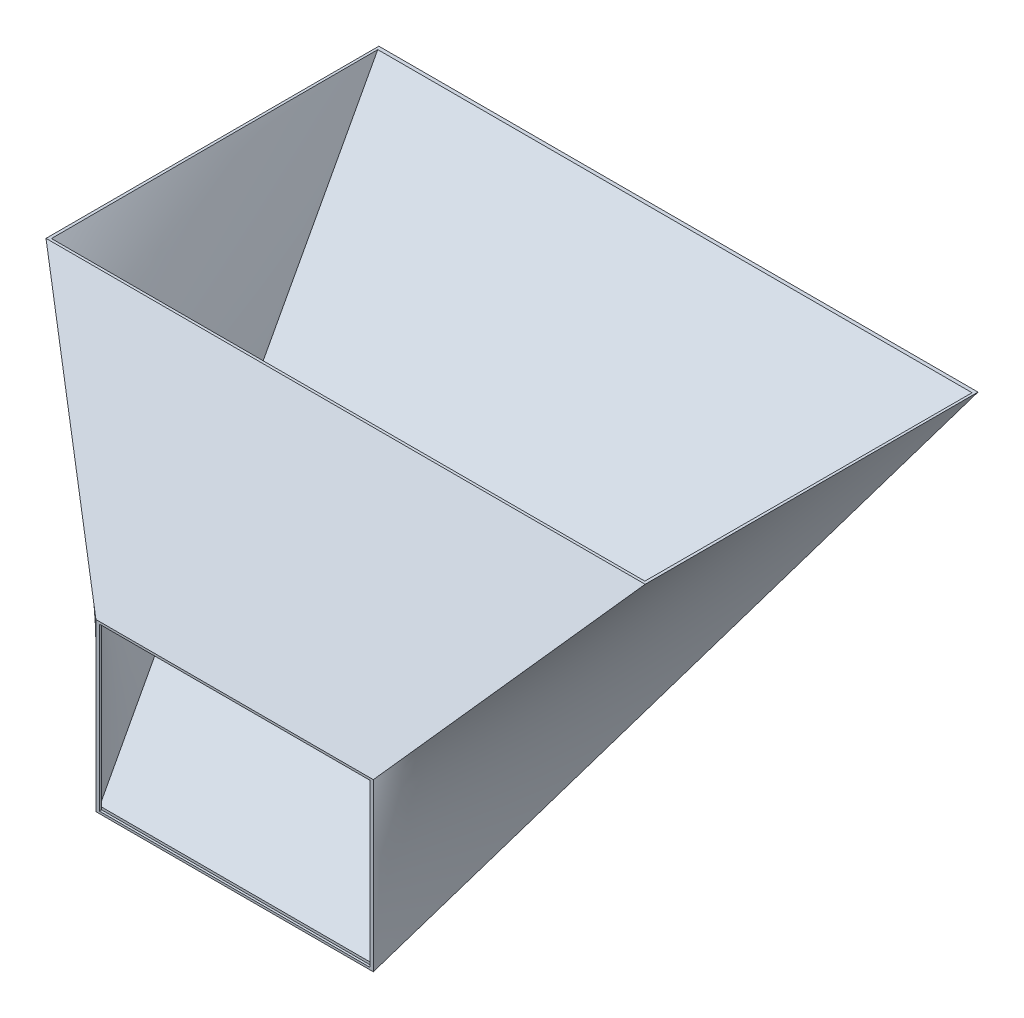
from build123d import *

# Parameters (mm, degrees)
SHELL1_T           = -2
SKETCH4_W          = 244
SKETCH4_H          = 146
CUT_EXTRUDE1_DEPTH = 2


with BuildPart() as part:
    # Loft1: read off the stored shape, not the designer's step
    # Loft1: loft between two sections, ruled curve by curve
    loft1_from = [
        Edge.make_bspline([(270, 0, -150), (270, 0, -100), (270, 0, -50), (270, 0, 50), (270, 0, 100), (270, 0, 150)], [0, 0, 0, 0, 0.5, 0.5, 1, 1, 1, 1], 3),
        Edge.make_bspline([(-270, 0, 150), (-270, 0, 100), (-270, 0, 50), (-270, 0, -50), (-270, 0, -100), (-270, 0, -150)], [0, 0, 0, 0, 0.5, 0.5, 1, 1, 1, 1], 3),
        Edge.make_line((-270, 0, 150), (270, 0, 150)),
        Edge.make_line((270, 0, -150), (-270, 0, -150)),
    ]
    loft1_to = [
        Edge.make_bspline([(125, -325, 250), (125, -300, 250), (125, -275, 250), (125, -225, 250), (125, -200, 250), (125, -175, 250)], [0, 0, 0, 0, 0.5, 0.5, 1, 1, 1, 1], 3),
        Edge.make_bspline([(-125, -175, 250), (-125, -200, 250), (-125, -225, 250), (-125, -275, 250), (-125, -300, 250), (-125, -325, 250)], [0, 0, 0, 0, 0.5, 0.5, 1, 1, 1, 1], 3),
        Edge.make_line((-125, -175, 250), (125, -175, 250)),
        Edge.make_line((125, -325, 250), (-125, -325, 250)),
    ]
    loft1 = Solid(Shell([*[Face.make_surface_from_curves(loft1_from[k], loft1_to[k]) for k in range(4)], Face(Wire(loft1_from)), Face(Wire(loft1_to))]))
    add(loft1)

    # Shell1
    shell1_openings = [part.faces().sort_by_distance(p)[0] for p in [
        (0, 0, 0),
    ]]
    offset(amount=SHELL1_T, openings=shell1_openings, kind=Kind.INTERSECTION)

    # Sketch4 → Cut-Extrude1 (cut)
    with BuildSketch(Plane.XY.offset(250)):
        with Locations((0, -250)):
            Rectangle(SKETCH4_W, SKETCH4_H)
    extrude(amount=-CUT_EXTRUDE1_DEPTH, mode=Mode.SUBTRACT)


solid = part.part
